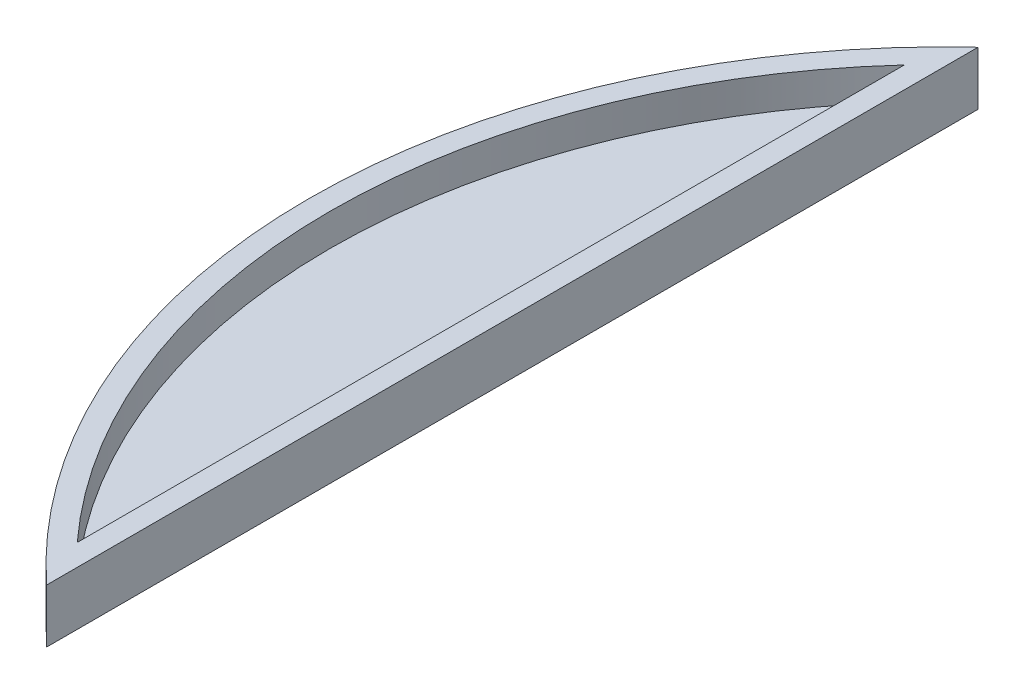
from build123d import *

# Parameters (mm, degrees)
BOSS_EXTRUDE1_DEPTH = 6.35
SHELL1_T            = -2.54


with BuildPart() as part:
    # Sketch1 → Boss-Extrude1 (new body)
    with BuildSketch(Plane(origin=(0, 0, 0), x_dir=(1, 0, 0), z_dir=(0, 1, 0))):
        with BuildLine():
            Line((0, -109.982), (0, 0))
            ThreePointArc((0, 0), (-24.033096175, -54.991), (0, -109.982))
        make_face()
    extrude(amount=BOSS_EXTRUDE1_DEPTH)

    # Shell1
    shell1_openings = [part.faces().sort_by_distance(p)[0] for p in [
        (-9.758992927, 6.35, 54.991),
    ]]
    offset(amount=SHELL1_T, openings=shell1_openings)


solid = part.part
